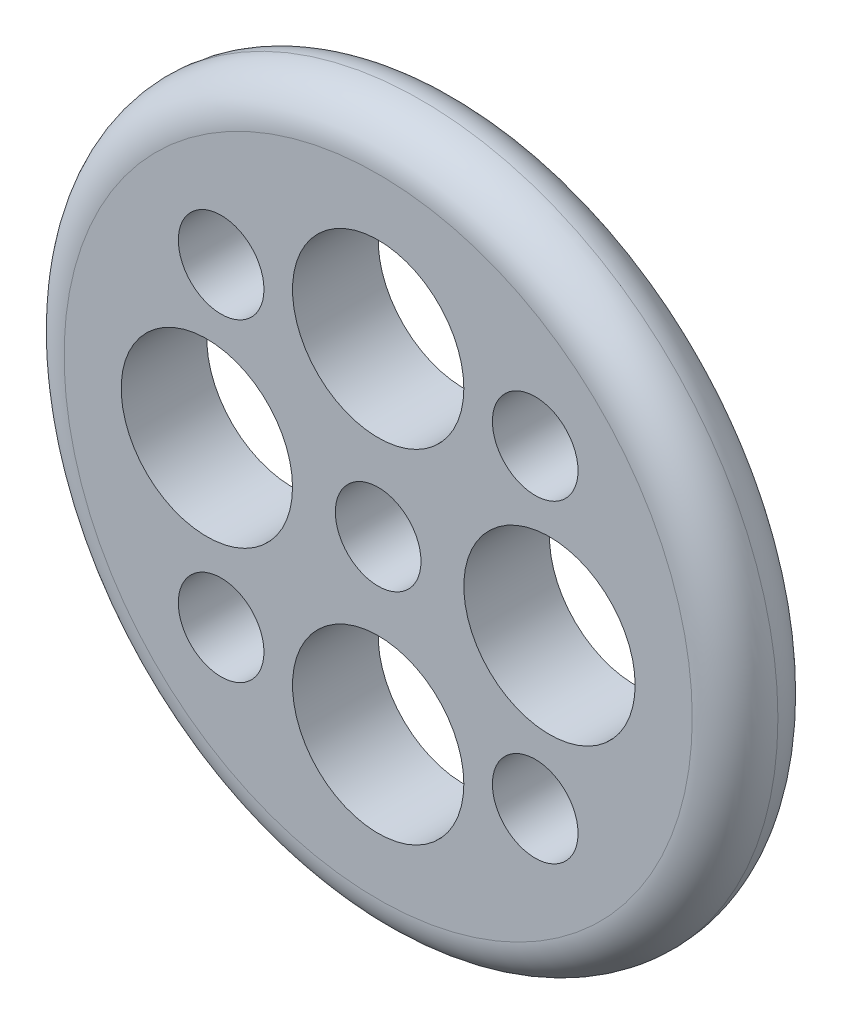
from build123d import *

# Parameters (mm, degrees)
SKETCH1_R           = 125
BOSS_EXTRUDE1_DEPTH = 30
FILLET1_R           = 15
SKETCH2_R           = 15
CUT_EXTRUDE1_DEPTH  = 30
SKETCH3_R           = 30
SKETCH3_R_2         = 15
CUT_EXTRUDE2_DEPTH  = 50


with BuildPart() as part:
    # Sketch1 → Boss-Extrude1 (new body)
    with BuildSketch(Plane.XY):
        Circle(SKETCH1_R)
    extrude(amount=BOSS_EXTRUDE1_DEPTH)

    # Fillet1
    fillet1_edges = [part.edges().sort_by_distance(p)[0] for p in [
        (-125, 0, 0),
        (-125, 0, 30),
    ]]
    fillet(fillet1_edges, radius=FILLET1_R - 0.0001)  # a hair under: the kernel refuses the full size

    # Sketch2 → Cut-Extrude1 (cut)
    with BuildSketch(Plane.XY.offset(30)):
        Circle(SKETCH2_R)
    extrude(amount=-CUT_EXTRUDE1_DEPTH, mode=Mode.SUBTRACT)

    # Sketch3 → Cut-Extrude2 (cut)
    with BuildSketch(Plane.XY.offset(30)):
        with Locations((0, 60)):
            Circle(SKETCH3_R)
        with Locations((-60, 0)):
            Circle(SKETCH3_R)
        with Locations((0, -60)):
            Circle(SKETCH3_R)
        with Locations((60, 0)):
            Circle(SKETCH3_R)
        with Locations((55, -55)):
            Circle(SKETCH3_R_2)
        with Locations((-55, -55)):
            Circle(SKETCH3_R_2)
        with Locations((-55, 55)):
            Circle(SKETCH3_R_2)
        with Locations((55, 55)):
            Circle(SKETCH3_R_2)
    extrude(amount=-CUT_EXTRUDE2_DEPTH, mode=Mode.SUBTRACT)


solid = part.part
